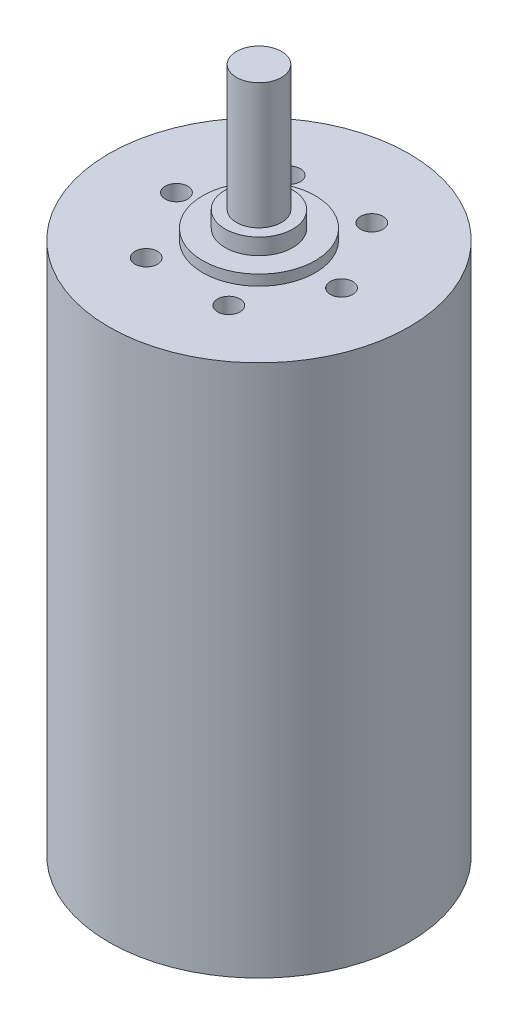
from build123d import *

# Parameters (mm, degrees)
SKETCH1_R           = 20
BOSS_EXTRUDE1_DEPTH = 71
SKETCH2_R           = 7.5
BOSS_EXTRUDE2_DEPTH = 1.4
SKETCH3_R           = 4.5
BOSS_EXTRUDE3_DEPTH = 2.15
SKETCH4_R           = 3
BOSS_EXTRUDE4_DEPTH = 16.75
SKETCH5_R           = 1.5
CUT_EXTRUDE1_DEPTH  = 5
CIRPATTERN1_COUNT   = 6


with BuildPart() as part:
    # Sketch1 → Boss-Extrude1 (new body)
    with BuildSketch(Plane(origin=(0, 0, 0), x_dir=(1, 0, 0), z_dir=(0, 1, 0))):
        Circle(SKETCH1_R)
    extrude(amount=BOSS_EXTRUDE1_DEPTH)

    # Sketch2 → Boss-Extrude2 (add)
    with BuildSketch(Plane(origin=(0, 71, 0), x_dir=(1, 0, 0), z_dir=(0, 1, 0))):
        Circle(SKETCH2_R)
    extrude(amount=BOSS_EXTRUDE2_DEPTH)

    # Sketch3 → Boss-Extrude3 (add)
    with BuildSketch(Plane(origin=(0, 72.4, 0), x_dir=(1, 0, 0), z_dir=(0, 1, 0))):
        Circle(SKETCH3_R)
    extrude(amount=BOSS_EXTRUDE3_DEPTH)

    # Sketch4 → Boss-Extrude4 (add)
    with BuildSketch(Plane(origin=(0, 74.55, 0), x_dir=(1, 0, 0), z_dir=(0, 1, 0))):
        Circle(SKETCH4_R)
    extrude(amount=BOSS_EXTRUDE4_DEPTH)

    # Sketch5 → Cut-Extrude1 (cut)
    with BuildSketch(Plane(origin=(0, 71, 0), x_dir=(1, 0, 0), z_dir=(0, 1, 0))):
        with Locations((-11, 0)):
            Circle(SKETCH5_R)
    cut_extrude1 = extrude(amount=-CUT_EXTRUDE1_DEPTH, mode=Mode.SUBTRACT)

    # CirPattern1: Cut-Extrude1 ×6 about axis
    cirpattern1_axis = Axis((0, 91.3, 0), (0, -1, 0))
    for i in range(1, CIRPATTERN1_COUNT):
        add(cut_extrude1.rotate(cirpattern1_axis, i * 360 / CIRPATTERN1_COUNT), mode=Mode.SUBTRACT)


solid = part.part
